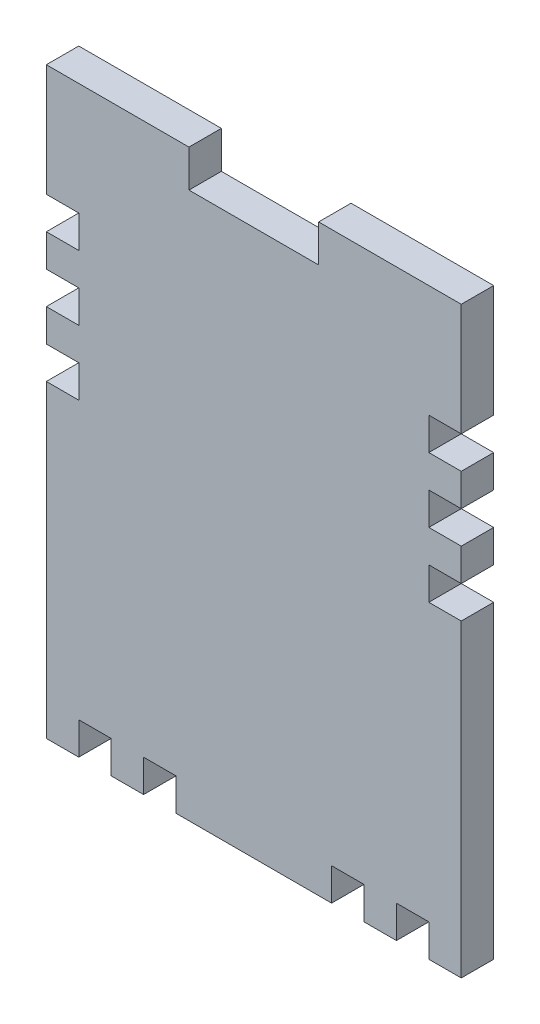
from build123d import *

# Parameters (mm, degrees)
BOSS_EXTRU_1_DEPTH = 5


with BuildPart() as part:
    # Esquisse2 → Boss.-Extru.1 (new body)
    with BuildSketch(Plane.XY):
        Polygon((72.436017117, 166.854307047), (72.436017117, 161.108741686), (52.436017117, 161.108741686), (52.436017117, 166.854307047), (30.436017117, 166.854307047), (30.436017117, 149.544307047), (35.436017117, 149.544307047), (35.436017117, 144.544307047), (30.436017117, 144.544307047), (30.436017117, 139.544307047), (35.436017117, 139.544307047), (35.436017117, 134.544307047), (30.436017117, 134.544307047), (30.436017117, 129.544307047), (35.436017117, 129.544307047), (35.436017117, 124.544307047), (30.436017117, 124.544307047), (30.436017117, 76.854307047), (35.436017117, 76.854307047), (35.436017117, 81.854307047), (40.436017117, 81.854307047), (40.436017117, 76.854307047), (45.436017117, 76.854307047), (45.436017117, 81.854307047), (50.436017117, 81.854307047), (50.436017117, 76.854307047), (74.436017117, 76.854307047), (74.436017117, 81.854307047), (79.436017117, 81.854307047), (79.436017117, 76.854307047), (84.436017117, 76.854307047), (84.436017117, 81.854307047), (89.436017117, 81.854307047), (89.436017117, 76.854307047), (94.436017117, 76.854307047), (94.436017117, 124.544307047), (89.436017117, 124.544307047), (89.436017117, 129.544307047), (94.436017117, 129.544307047), (94.436017117, 134.544307047), (89.436017117, 134.544307047), (89.436017117, 139.544307047), (94.436017117, 139.544307047), (94.436017117, 144.544307047), (89.436017117, 144.544307047), (89.436017117, 149.544307047), (94.436017117, 149.544307047), (94.436017117, 166.854307047), align=None)
    extrude(amount=BOSS_EXTRU_1_DEPTH)


solid = part.part
